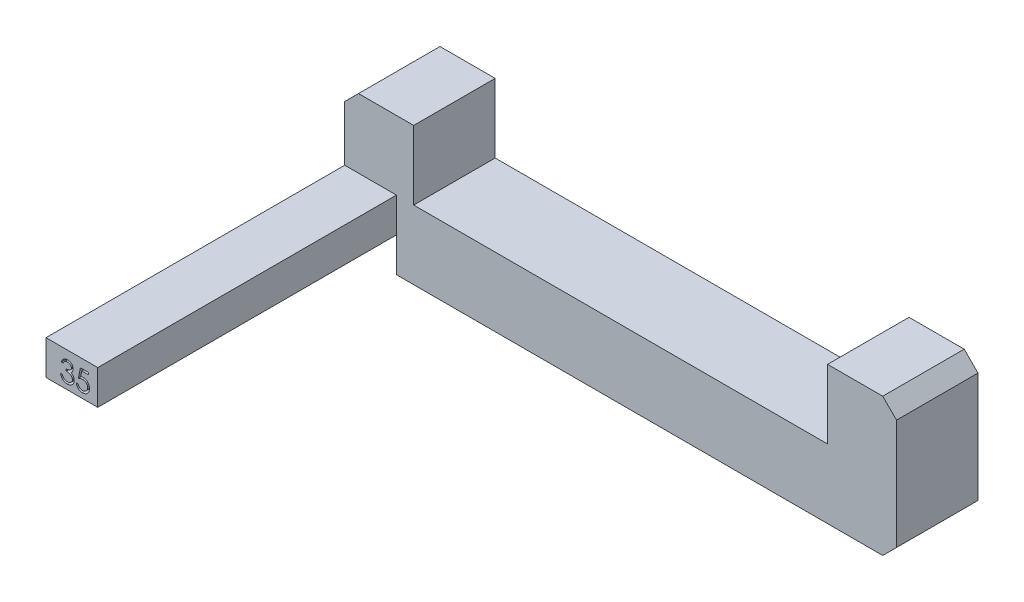
from build123d import *

# Parameters (mm, degrees)
BOSS_EXTRUDE1_DEPTH = 15
SKETCH2_W           = 9.525
SKETCH2_H           = 6.35
BOSS_EXTRUDE2_DEPTH = 55
CUT_EXTRUDE1_DEPTH  = 2
CHAMFER1_SIZE       = 2.54
SKETCH4_W           = 9.525
SKETCH4_H           = 6.35
CUT_EXTRUDE2_DEPTH  = 119.290828179


with BuildPart() as part:
    # Sketch1 → Boss-Extrude1 (new body)
    with BuildSketch(Plane.XY):
        Polygon((-101.6, 0), (0, 0), (0, 25.4), (-12.7, 25.4), (-12.7, 12.7), (-88.9, 12.7), (-88.9, 25.4), (-101.6, 25.4), align=None)
    extrude(amount=BOSS_EXTRUDE1_DEPTH)

    # Sketch2 → Boss-Extrude2 (add)
    with BuildSketch(Plane.XY.offset(15)):
        with Locations((-96.8375, 9.525)):
            Rectangle(SKETCH2_W, SKETCH2_H)
    extrude(amount=BOSS_EXTRUDE2_DEPTH)

    # Sketch3 → Cut-Extrude1 (cut)
    with BuildSketch(Plane.XY.offset(70)):
        with BuildLine():
            Line((-98.442638889, 10.215358974), (-98.775064103, 10.215358974))
            add(Edge.make_bspline(
                [(-98.775064103, 10.215358974), (-98.766058161, 10.252646687), (-98.748452283, 10.325541114), (-98.711730685, 10.429688798), (-98.671726473, 10.528244525), (-98.62368967, 10.61936287), (-98.571292906, 10.704875042), (-98.511261359, 10.782841532), (-98.446364652, 10.855245254), (-98.374583248, 10.919500097), (-98.299305414, 10.97768486), (-98.219470441, 11.027294296), (-98.136684546, 11.069970691), (-98.050374147, 11.10512877), (-97.960282282, 11.131614116), (-97.86722343, 11.150830068), (-97.770953726, 11.163308998), (-97.705604193, 11.164526888), (-97.672421541, 11.165145299)],
                knots=[0, 0, 0, 0, 1.162005537, 2.271625781, 3.343758855, 4.383309926, 5.390229558, 6.379919256, 7.361854164, 8.333198761, 9.295911338, 10.242430842, 11.177959212, 12.116337295, 13.062827104, 14.020064771, 14.994644689, 16, 16, 16, 16], degree=3))
            add(Edge.make_bspline(
                [(-97.672421541, 11.165145299), (-97.624073972, 11.163685614), (-97.528433436, 11.160798083), (-97.387925878, 11.134430304), (-97.252430828, 11.092705373), (-97.123431374, 11.035054012), (-97.003608533, 10.963947438), (-96.896996068, 10.879318092), (-96.805039061, 10.782798831), (-96.727892511, 10.676190201), (-96.667488137, 10.562254786), (-96.622946725, 10.444991287), (-96.595830446, 10.324677867), (-96.59231619, 10.24344308), (-96.590555556, 10.202744625)],
                knots=[0, 0, 0, 0, 1.083050992, 2.142477498, 3.193116406, 4.255571735, 5.30263384, 6.308962982, 7.297363603, 8.282367274, 9.249857812, 10.179914175, 11.08814088, 12, 12, 12, 12], degree=3))
            add(Edge.make_bspline(
                [(-96.590555556, 10.202744625), (-96.591787023, 10.1635791), (-96.594196813, 10.086938247), (-96.614658318, 9.975049662), (-96.64909253, 9.869595635), (-96.696791362, 9.770132239), (-96.758536169, 9.677290117), (-96.83333144, 9.590860382), (-96.92170509, 9.51045969), (-96.9886753, 9.464401581), (-97.023153546, 9.440689503)],
                knots=[0, 0, 0, 0, 1.024540389, 2.004866551, 2.965041327, 3.920577974, 4.882998113, 5.874504559, 6.905732034, 8, 8, 8, 8], degree=3))
            add(Edge.make_bspline(
                [(-97.023153546, 9.440689503), (-96.983749939, 9.421662605), (-96.905679997, 9.383964817), (-96.79926402, 9.31003414), (-96.702661602, 9.224672839), (-96.648788499, 9.158058531), (-96.621720419, 9.124588742)],
                knots=[0, 0, 0, 0, 1.015518401, 2.012035669, 3.001164323, 4, 4, 4, 4], degree=3))
            add(Edge.make_bspline(
                [(-96.621720419, 9.124588742), (-96.603896665, 9.100185955), (-96.568541034, 9.051779993), (-96.524900094, 8.973953942), (-96.485308781, 8.895265283), (-96.454458132, 8.813604912), (-96.430567457, 8.729919305), (-96.413490156, 8.64406477), (-96.402881273, 8.555971196), (-96.401361981, 8.496373821), (-96.400598291, 8.4664165)],
                knots=[0, 0, 0, 0, 1.025084078, 2.033381695, 3.024893161, 4.013698104, 4.991890475, 5.976764909, 6.982997093, 8, 8, 8, 8], degree=3))
            add(Edge.make_bspline(
                [(-96.400598291, 8.4664165), (-96.402497484, 8.414547878), (-96.406286933, 8.31105473), (-96.440157912, 8.158152316), (-96.492665258, 8.008688659), (-96.567232182, 7.865734454), (-96.658108629, 7.731981884), (-96.766225131, 7.612309457), (-96.890353246, 7.509440934), (-97.028789225, 7.423493443), (-97.178773186, 7.354788642), (-97.339190687, 7.307102848), (-97.507730327, 7.276044999), (-97.623308051, 7.272714563), (-97.682067808, 7.271021368)],
                knots=[0, 0, 0, 0, 0.955779014, 1.907060117, 2.875433937, 3.871313158, 4.872415639, 5.851225146, 6.836215519, 7.83643374, 8.849228613, 9.86973379, 10.916971861, 12, 12, 12, 12], degree=3))
            add(Edge.make_bspline(
                [(-97.682067808, 7.271021368), (-97.721669901, 7.271940227), (-97.799593614, 7.273748235), (-97.914151317, 7.286108088), (-98.023500115, 7.308682343), (-98.127787856, 7.339060008), (-98.227107186, 7.377574602), (-98.321155031, 7.42553689), (-98.410510002, 7.48195823), (-98.494328892, 7.547504611), (-98.572601709, 7.620827362), (-98.643248342, 7.703228147), (-98.707446623, 7.793183733), (-98.763477582, 7.891738968), (-98.813893357, 7.997620198), (-98.85535987, 8.112183192), (-98.891857097, 8.234403782), (-98.908825846, 8.319576057), (-98.917532051, 8.363275641)],
                knots=[0, 0, 0, 0, 1.048658725, 2.063410685, 3.046034179, 4.001477787, 4.936774919, 5.862367409, 6.792675028, 7.730719943, 8.675894397, 9.627829632, 10.600096036, 11.597688215, 12.626045268, 13.701542398, 14.82072376, 16, 16, 16, 16], degree=3))
            Line((-98.917532051, 8.363275641), (-98.585106838, 8.363275641))
            add(Edge.make_bspline(
                [(-98.585106838, 8.363275641), (-98.576446187, 8.334754602), (-98.559600471, 8.279278704), (-98.530925672, 8.199437714), (-98.498256751, 8.126245441), (-98.46321051, 8.05916497), (-98.426403321, 7.997535677), (-98.385218358, 7.942987199), (-98.342706013, 7.89312361), (-98.310660364, 7.865030562), (-98.294976796, 7.85128145)],
                knots=[0, 0, 0, 0, 1.198163088, 2.33053128, 3.407730985, 4.417276592, 5.372219308, 6.28897303, 7.162600585, 8, 8, 8, 8], degree=3))
            add(Edge.make_bspline(
                [(-98.294976796, 7.85128145), (-98.274237086, 7.835291797), (-98.232821685, 7.803361847), (-98.16533364, 7.76261429), (-98.094356635, 7.727307205), (-98.018352772, 7.70033696), (-97.93896214, 7.677500602), (-97.854901512, 7.662556386), (-97.766912507, 7.652303072), (-97.706833291, 7.651398269), (-97.676131644, 7.650935897)],
                knots=[0, 0, 0, 0, 0.946170439, 1.889420265, 2.845303464, 3.807233317, 4.801018734, 5.828864929, 6.890507805, 8, 8, 8, 8], degree=3))
            add(Edge.make_bspline(
                [(-97.676131644, 7.650935897), (-97.64146752, 7.65158773), (-97.573684819, 7.652862334), (-97.474778426, 7.664584123), (-97.380684711, 7.681655478), (-97.292448364, 7.708021718), (-97.208913577, 7.740598119), (-97.131251332, 7.781501015), (-97.058442119, 7.829490845), (-96.991418499, 7.884036455), (-96.93115117, 7.943749204), (-96.878086852, 8.006204704), (-96.832975751, 8.071139624), (-96.796586465, 8.138913301), (-96.767852132, 8.209245085), (-96.748290745, 8.282332346), (-96.734689558, 8.357576953), (-96.733581893, 8.408725112), (-96.733023504, 8.434509615)],
                knots=[0, 0, 0, 0, 1.217147791, 2.380027433, 3.494444702, 4.572153297, 5.609568379, 6.639424714, 7.649109417, 8.668170816, 9.669597737, 10.625200337, 11.543417969, 12.441394052, 13.322311151, 14.205496177, 15.095365482, 16, 16, 16, 16], degree=3))
            add(Edge.make_bspline(
                [(-96.733023504, 8.434509615), (-96.734643073, 8.469023282), (-96.737874153, 8.537878881), (-96.762542399, 8.639179981), (-96.803117697, 8.736783092), (-96.859921105, 8.82902297), (-96.929068085, 8.914510799), (-97.009887611, 8.990786451), (-97.103050819, 9.053725631), (-97.188796848, 9.097211126), (-97.264748305, 9.126883697), (-97.329746253, 9.146648034), (-97.402513659, 9.163384153), (-97.482170544, 9.178954641), (-97.569317115, 9.192206401), (-97.663858495, 9.203257322), (-97.765813843, 9.212099741), (-97.836395327, 9.216048483), (-97.872767094, 9.218083333)],
                knots=[0, 0, 0, 0, 1.07054697, 2.135767047, 3.216561865, 4.33974944, 5.486079747, 6.621378074, 7.775625952, 8.963672916, 9.598146892, 10.304877434, 11.070270905, 11.915000392, 12.823868403, 13.805723172, 14.86925407, 16, 16, 16, 16], degree=3))
            Line((-97.872767094, 9.218083333), (-97.872767094, 9.597997863))
            add(Edge.make_bspline(
                [(-97.872767094, 9.597997863), (-97.826940027, 9.598775531), (-97.73717606, 9.60029879), (-97.606054588, 9.618722267), (-97.480670332, 9.644207599), (-97.36380203, 9.683244427), (-97.257282142, 9.728583741), (-97.164868897, 9.781343996), (-97.087856999, 9.839991273), (-97.026620698, 9.905430784), (-96.980552265, 9.97561421), (-96.946868904, 10.048762672), (-96.926971892, 10.125517303), (-96.924315828, 10.17789916), (-96.922980769, 10.204228666)],
                knots=[0, 0, 0, 0, 1.321986639, 2.589447074, 3.816329219, 5.01088745, 6.139805852, 7.153945165, 8.075214402, 8.924034688, 9.728124013, 10.488707548, 11.240355623, 12, 12, 12, 12], degree=3))
            add(Edge.make_bspline(
                [(-96.922980769, 10.204228666), (-96.923419354, 10.223572613), (-96.924291898, 10.262056478), (-96.935295684, 10.318280509), (-96.951831127, 10.372785677), (-96.974563841, 10.425340192), (-97.004991134, 10.475579566), (-97.041404137, 10.523932116), (-97.084762043, 10.570121782), (-97.134445974, 10.61317512), (-97.187798468, 10.654205896), (-97.246271146, 10.689039495), (-97.308100964, 10.718826353), (-97.373356374, 10.743389742), (-97.442249143, 10.761867489), (-97.514455583, 10.775134588), (-97.590113382, 10.783429439), (-97.641730131, 10.784623679), (-97.667969418, 10.785230769)],
                knots=[0, 0, 0, 0, 0.884392785, 1.759457502, 2.611959086, 3.489218968, 4.37281399, 5.2945488, 6.255912374, 7.266815255, 8.301784654, 9.332968512, 10.37626691, 11.440494194, 12.520033166, 13.637162961, 14.798855837, 16, 16, 16, 16], degree=3))
            add(Edge.make_bspline(
                [(-97.667969418, 10.785230769), (-97.710145766, 10.783758244), (-97.792525985, 10.780882061), (-97.911286772, 10.755690538), (-98.0216914, 10.715497067), (-98.106081489, 10.667519621), (-98.16839888, 10.620158745), (-98.212930306, 10.578796553), (-98.25666118, 10.532830148), (-98.296714521, 10.479428368), (-98.337221146, 10.422207681), (-98.374098307, 10.358259285), (-98.409933148, 10.289251301), (-98.431525847, 10.240466754), (-98.442638889, 10.215358974)],
                knots=[0, 0, 0, 0, 1.472543308, 2.876219568, 4.221790263, 5.565193594, 6.249813518, 6.953379497, 7.687249741, 8.463570142, 9.283606569, 10.136032583, 11.040678096, 12, 12, 12, 12], degree=3))
        make_face()
        with BuildLine():
            Line((-93.741196581, 11.070166667), (-93.741196581, 10.690252137))
            Line((-93.741196581, 10.690252137), (-95.001147503, 10.690252137))
            Line((-95.001147503, 10.690252137), (-95.200751035, 9.715979133))
            add(Edge.make_bspline(
                [(-95.200751035, 9.715979133), (-95.161533568, 9.726806171), (-95.085555928, 9.747781844), (-94.973415075, 9.771071284), (-94.866954993, 9.785110546), (-94.797871893, 9.787027516), (-94.764442942, 9.787955128)],
                knots=[0, 0, 0, 0, 1.100273476, 2.13160584, 3.095893838, 4, 4, 4, 4], degree=3))
            add(Edge.make_bspline(
                [(-94.764442942, 9.787955128), (-94.723079318, 9.787059846), (-94.641748097, 9.785299498), (-94.522750211, 9.768395958), (-94.409156233, 9.741789548), (-94.301203724, 9.704620329), (-94.198692975, 9.657090861), (-94.102567139, 9.597718425), (-94.011383348, 9.528362316), (-93.926777436, 9.448622178), (-93.850022543, 9.360863467), (-93.782536871, 9.26650472), (-93.725214796, 9.166462944), (-93.679112997, 9.0597823), (-93.642299577, 8.947642196), (-93.617797049, 8.828862713), (-93.601481032, 8.704563453), (-93.599658173, 8.619574449), (-93.598728632, 8.576235544)],
                knots=[0, 0, 0, 0, 1.052922333, 2.070308379, 3.05430497, 4.020497103, 4.973039431, 5.925935799, 6.892292201, 7.88610001, 8.88166317, 9.857072816, 10.836096531, 11.812156883, 12.81219415, 13.836441305, 14.89672472, 16, 16, 16, 16], degree=3))
            add(Edge.make_bspline(
                [(-93.598728632, 8.576235544), (-93.599432504, 8.546049527), (-93.600830734, 8.486085432), (-93.60794124, 8.397032819), (-93.621631539, 8.309865488), (-93.64001238, 8.224571873), (-93.663869773, 8.141313454), (-93.692750688, 8.05985192), (-93.728094817, 7.980694295), (-93.766863023, 7.903091585), (-93.810515545, 7.828798165), (-93.858964466, 7.759319654), (-93.910151277, 7.69361379), (-93.96522841, 7.632385256), (-94.024707797, 7.576036395), (-94.087869095, 7.524232797), (-94.154208306, 7.476098389), (-94.224751771, 7.433587049), (-94.297927565, 7.394467921), (-94.374792428, 7.36237551), (-94.453596669, 7.333683535), (-94.535474496, 7.310813451), (-94.620240448, 7.292893165), (-94.708034252, 7.280721696), (-94.798395461, 7.271856633), (-94.859646516, 7.271301688), (-94.890586438, 7.271021368)],
                knots=[0, 0, 0, 0, 1.056347294, 2.098418968, 3.122841568, 4.141288669, 5.149314143, 6.15115421, 7.162517403, 8.180376062, 9.185164535, 10.17417709, 11.141909838, 12.097768115, 13.052685741, 14.0056014, 14.954263652, 15.917497458, 16.885230207, 17.854509472, 18.828990115, 19.81800267, 20.826176721, 21.857883937, 22.917946725, 24, 24, 24, 24], degree=3))
            add(Edge.make_bspline(
                [(-94.890586438, 7.271021368), (-94.927494946, 7.271752504), (-95.000108075, 7.27319093), (-95.106492342, 7.288238827), (-95.208848633, 7.309790638), (-95.30635299, 7.342214024), (-95.399879244, 7.382840577), (-95.488168287, 7.434186859), (-95.573476067, 7.492373077), (-95.652334639, 7.561038117), (-95.725524859, 7.636090547), (-95.791042581, 7.717537384), (-95.849392283, 7.804034377), (-95.899639565, 7.89600159), (-95.942499971, 7.993197369), (-95.976170834, 8.095985878), (-96.003347093, 8.203830049), (-96.014844213, 8.278075847), (-96.020683761, 8.315786325)],
                knots=[0, 0, 0, 0, 1.0467383, 2.05933395, 3.04377827, 4.011590433, 4.970194871, 5.932262533, 6.905835911, 7.896367577, 8.894135286, 9.877477877, 10.858688626, 11.851381753, 12.8477658, 13.868841284, 14.917554742, 16, 16, 16, 16], degree=3))
            Line((-96.020683761, 8.315786325), (-95.688258547, 8.315786325))
            add(Edge.make_bspline(
                [(-95.688258547, 8.315786325), (-95.680079157, 8.280462913), (-95.664357916, 8.212569353), (-95.629850165, 8.11718035), (-95.58765878, 8.032175838), (-95.537489178, 7.956431363), (-95.477640396, 7.890381841), (-95.40934675, 7.83152045), (-95.332778743, 7.778418438), (-95.247695908, 7.73415601), (-95.157935399, 7.696406579), (-95.063990102, 7.671269368), (-94.968418002, 7.653594257), (-94.903776727, 7.651824977), (-94.871293904, 7.650935897)],
                knots=[0, 0, 0, 0, 1.136247022, 2.183929868, 3.172523383, 4.106158343, 5.02341133, 5.958108904, 6.928429099, 7.938127109, 8.96079061, 9.975095812, 10.982467395, 12, 12, 12, 12], degree=3))
            add(Edge.make_bspline(
                [(-94.871293904, 7.650935897), (-94.839587883, 7.651804554), (-94.77715847, 7.653514946), (-94.685283086, 7.666679567), (-94.596581127, 7.686954663), (-94.511927841, 7.717296927), (-94.429841878, 7.754174254), (-94.352399638, 7.801497709), (-94.27736076, 7.855959562), (-94.207057652, 7.918355329), (-94.142669235, 7.987114922), (-94.08577734, 8.060645163), (-94.03838844, 8.139085493), (-93.998453174, 8.221077913), (-93.968128433, 8.307521052), (-93.946495061, 8.398009796), (-93.933791824, 8.49276765), (-93.932044325, 8.557399336), (-93.931153846, 8.590333934)],
                knots=[0, 0, 0, 0, 1.027316725, 2.022795036, 3.002884548, 3.971462791, 4.93288096, 5.914575861, 6.907176829, 7.935150275, 8.956128384, 9.956726525, 10.942570165, 11.921478529, 12.907843606, 13.90538589, 14.932640048, 16, 16, 16, 16], degree=3))
            add(Edge.make_bspline(
                [(-93.931153846, 8.590333934), (-93.931850737, 8.620047438), (-93.933214801, 8.678207394), (-93.944359655, 8.763296554), (-93.963745117, 8.843807191), (-93.990652057, 8.920128088), (-94.024814536, 8.992331231), (-94.066561883, 9.060491137), (-94.116677563, 9.123709444), (-94.173924811, 9.182015729), (-94.236639571, 9.235826555), (-94.305900866, 9.281699047), (-94.380259288, 9.320290026), (-94.458818948, 9.353593658), (-94.543448465, 9.37751278), (-94.632471901, 9.395470459), (-94.726850584, 9.405858384), (-94.791377895, 9.407299716), (-94.824546608, 9.408040598)],
                knots=[0, 0, 0, 0, 1.045622112, 2.046656509, 3.013763289, 3.955457236, 4.890082067, 5.820317437, 6.762574623, 7.722996705, 8.69280354, 9.665887285, 10.63943826, 11.638615906, 12.663482002, 13.728887084, 14.832589034, 16, 16, 16, 16], degree=3))
            add(Edge.make_bspline(
                [(-94.824546608, 9.408040598), (-94.853258058, 9.407426139), (-94.912539917, 9.406157437), (-95.003474909, 9.396816062), (-95.099033649, 9.381746142), (-95.198849823, 9.361017363), (-95.303223194, 9.33389114), (-95.411933502, 9.30138496), (-95.525209317, 9.262520845), (-95.601533909, 9.233170919), (-95.640769231, 9.218083333)],
                knots=[0, 0, 0, 0, 0.817624296, 1.688186739, 2.600797293, 3.572016777, 4.590301741, 5.671205678, 6.80286297, 8, 8, 8, 8], degree=3))
            Line((-95.640769231, 9.218083333), (-95.260854701, 11.070166667))
            Line((-95.260854701, 11.070166667), (-93.741196581, 11.070166667))
        make_face()
    extrude(amount=-CUT_EXTRUDE1_DEPTH, mode=Mode.SUBTRACT)

    # Chamfer1
    chamfer1_edges = [part.edges().sort_by_distance(p)[0] for p in [
        (0, 0, 7.5),
        (-101.6, 0, 7.5),
        (0, 25.4, 7.5),
        (-101.6, 25.4, 7.5),
    ]]
    chamfer(chamfer1_edges, length=CHAMFER1_SIZE)

    # Sketch4 → Cut-Extrude2 (cut, through all)
    with BuildSketch(Plane.XY.offset(15)):
        with Locations((-96.8375, 3.175)):
            Rectangle(SKETCH4_W, SKETCH4_H)
    extrude(amount=-CUT_EXTRUDE2_DEPTH, mode=Mode.SUBTRACT)


solid = part.part
